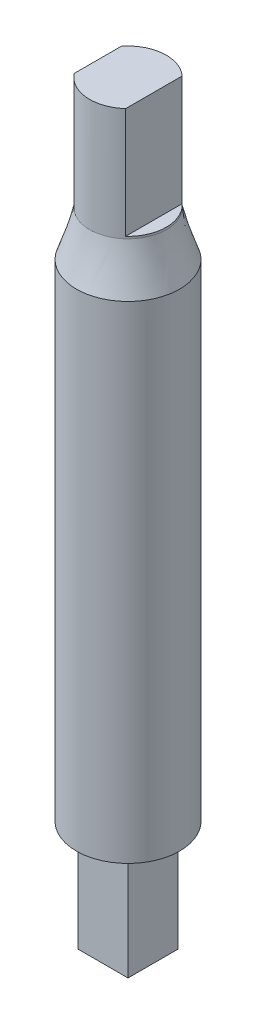
from build123d import *

# Parameters (mm, degrees)
SKETCH1_R           = 3.5
BOSS_EXTRUDE1_DEPTH = 33
SKETCH2_R           = 2.6
BOSS_EXTRUDE2_DEPTH = 3.19
BOSS_EXTRUDE3_DEPTH = 7.5
SKETCH5_W           = 3.4
SKETCH5_H           = 3.4
BOSS_EXTRUDE4_DEPTH = 7.5


with BuildPart() as part:
    # Sketch1 → Boss-Extrude1 (new body)
    with BuildSketch(Plane(origin=(0, 0, 0), x_dir=(1, 0, 0), z_dir=(0, 1, 0))):
        with Locations(Location((0, 0, 0), (0, 0, 270))):
            Circle(SKETCH1_R)
    extrude(amount=BOSS_EXTRUDE1_DEPTH)

    # Sketch2 → Boss-Extrude2 (add)
    with BuildSketch(Plane(origin=(0, 33, 0), x_dir=(1, 0, 0), z_dir=(0, 1, 0))):
        with Locations(Location((0, 0, 0), (0, 0, 90))):
            Circle(SKETCH2_R)
    extrude(amount=BOSS_EXTRUDE2_DEPTH)

    # Sketch4 → Boss-Extrude3 (add)
    with BuildSketch(Plane(origin=(0, 36.19, 0), x_dir=(1, 0, 0), z_dir=(0, 1, 0))):
        with BuildLine():
            Line((1.758185656, -1.915406798), (1.758185656, 1.915406798))
            ThreePointArc((1.758185656, 1.915406798), (-0.216604889, 2.59096166), (-2.051814344, 1.59689007))
            Line((-2.051814344, 1.59689007), (-2.051814344, -1.59689007))
            ThreePointArc((-2.051814344, -1.59689007), (-0.216604889, -2.59096166), (1.758185656, -1.915406798))
        make_face()
    extrude(amount=BOSS_EXTRUDE3_DEPTH)

    # Loft2: read off the stored shape, not the designer's step
    # Loft2: loft between two sections, ruled curve by curve
    loft2_from = [
        Edge.make_bspline([(0.603918101, 33, 3.447503869), (7.498925839, 33, 2.239667668), (6.291089638, 33, -4.65534007), (-0.603918101, 33, -3.447503869), (-7.498925839, 33, -2.239667668), (-6.291089638, 33, 4.65534007), (0.603918101, 33, 3.447503869)], [0, 0, 0, 0, 0.5, 0.5, 0.5, 1, 1, 1, 1], 3, [1, 0.333333333, 0.333333333, 1, 0.333333333, 0.333333333, 1]),
    ]
    loft2_to = [
        Edge.make_bspline([(1.447224244, 36.19, 2.123780118), (5.694784479, 36.19, -0.77066837), (2.800335991, 36.19, -5.018228605), (-1.447224244, 36.19, -2.123780118), (-5.694784479, 36.19, 0.77066837), (-2.800335991, 36.19, 5.018228605), (1.447224244, 36.19, 2.123780118)], [0, 0, 0, 0, 0.5, 0.5, 0.5, 1, 1, 1, 1], 3, [1, 0.333333333, 0.333333333, 1, 0.333333333, 0.333333333, 1]),
    ]
    loft2 = Solid(Shell([*[Face.make_surface_from_curves(loft2_from[k], loft2_to[k]) for k in range(1)], Face(Wire(loft2_from)), Face(Wire(loft2_to))]))
    add(loft2)

    # Sketch5 → Boss-Extrude4 (add)
    with BuildSketch(Plane.XZ):
        Rectangle(SKETCH5_W, SKETCH5_H)
    extrude(amount=BOSS_EXTRUDE4_DEPTH)


solid = part.part
